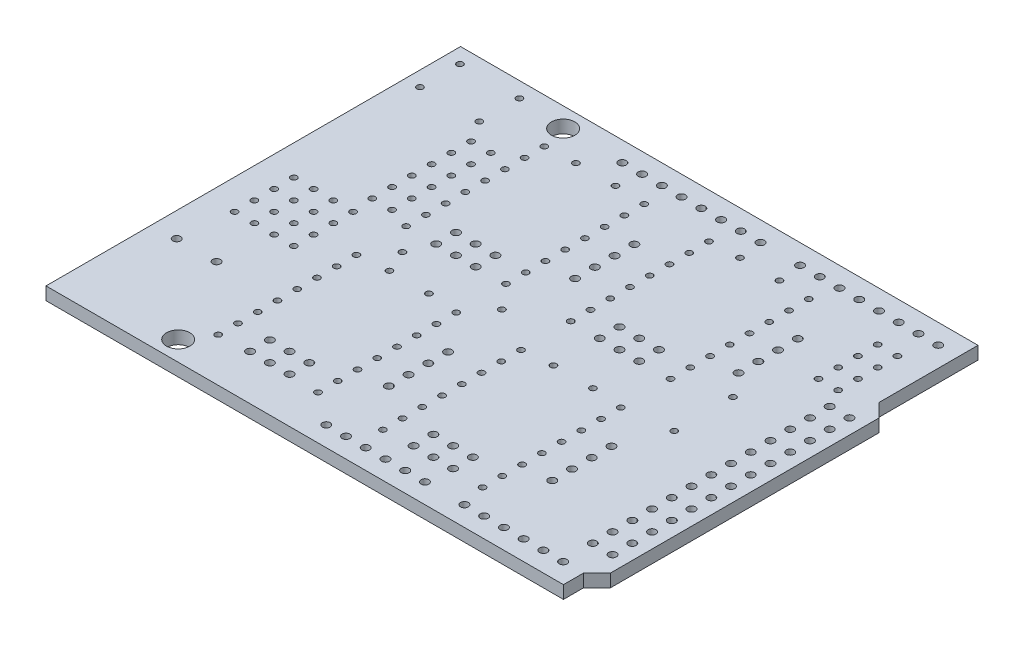
from build123d import *

# Parameters (mm, degrees)
SKETCH2_W             = 68.31
SKETCH2_H             = 53.34
BOSS_EXTRUDE1_DEPTH   = 1.65
SKETCH3_R             = 0.5
CUT_EXTRUDE1_DEPTH    = 87.68410581
SKETCH4_R             = 0.5
CUT_EXTRUDE2_DEPTH    = 87.68410581
SKETCH5_R             = 0.4
CUT_EXTRUDE3_DEPTH    = 87.68410581
LPATTERN4_COUNT       = 8
LPATTERN4_PITCH       = 2.54
LPATTERN5_COUNT       = 17
LPATTERN5_PITCH       = 2.54
LPATTERN6_COUNT       = 13
LPATTERN6_PITCH       = 2.54
SKETCH6_R             = 0.4
CUT_EXTRUDE4_DEPTH    = 87.68410581
LPATTERN7_COUNT       = 4
LPATTERN7_PITCH       = 2.54
LPATTERN7_COUNT_DIR2  = 4
LPATTERN7_PITCH_DIR2  = 2.54
SKETCH7_R             = 0.5
CUT_EXTRUDE5_DEPTH    = 87.68410581
SKETCH8_R             = 0.4
CUT_EXTRUDE6_DEPTH    = 87.68410581
LPATTERN8_COUNT       = 6
LPATTERN8_PITCH       = 2.54
LPATTERN8_COUNT_DIR2  = 2
LPATTERN8_PITCH_DIR2  = 2.54
SKETCH9_R             = 0.5
CUT_EXTRUDE7_DEPTH    = 87.68410581
LPATTERN9_COUNT       = 3
LPATTERN9_PITCH       = 2.54
LPATTERN9_COUNT_DIR2  = 2
LPATTERN9_PITCH_DIR2  = 2.54
SKETCH10_R            = 0.5
CUT_EXTRUDE8_DEPTH    = 87.68410581
LPATTERN10_COUNT      = 4
LPATTERN10_PITCH      = 2.54
SKETCH11_R            = 0.4
CUT_EXTRUDE9_DEPTH    = 87.68410581
LPATTERN11_COUNT      = 2
LPATTERN11_PITCH      = 5.08
SKETCH12_R            = 0.4
CUT_EXTRUDE10_DEPTH   = 87.68410581
SKETCH13_R            = 0.5
CUT_EXTRUDE11_DEPTH   = 87.68410581
LPATTERN12_COUNT      = 13
LPATTERN12_PITCH      = 2.54
LPATTERN12_COUNT_DIR2 = 2
LPATTERN12_PITCH_DIR2 = 2.54
SKETCH14_R            = 0.4
CUT_EXTRUDE12_DEPTH   = 87.68410581
LPATTERN13_COUNT      = 4
LPATTERN13_PITCH      = 2.54
LPATTERN13_COUNT_DIR2 = 2
LPATTERN13_PITCH_DIR2 = 2.54
SKETCH15_R            = 1.5
CUT_EXTRUDE13_DEPTH   = 87.68410581


with BuildPart() as part:
    # Sketch2 → Boss-Extrude1 (new body)
    with BuildSketch(Plane(origin=(0, 0, 0), x_dir=(1, 0, 0), z_dir=(0, 1, 0))):
        with Locations((34.155, 26.67)):
            Rectangle(SKETCH2_W, SKETCH2_H)
    extrude(amount=BOSS_EXTRUDE1_DEPTH)

    # Sketch3 → Cut-Extrude1 (cut, through all)
    with BuildSketch(Plane(origin=(0, 1.65, 0), x_dir=(1, 0, 0), z_dir=(0, 1, 0))):
        with Locations((64, 2.54)):
            Circle(SKETCH3_R)
    cut_extrude1 = extrude(amount=-CUT_EXTRUDE1_DEPTH, mode=Mode.SUBTRACT)

    # Sketch4 → Cut-Extrude2 (cut, through all)
    with BuildSketch(Plane(origin=(0, 1.65, 0), x_dir=(1, 0, 0), z_dir=(0, 1, 0))):
        with Locations((64, 50.8)):
            Circle(SKETCH4_R)
    cut_extrude2 = extrude(amount=-CUT_EXTRUDE2_DEPTH, mode=Mode.SUBTRACT)

    # Sketch5 → Cut-Extrude3 (cut, through all)
    with BuildSketch(Plane(origin=(0, 1.65, 0), x_dir=(1, 0, 0), z_dir=(0, 1, 0))):
        with Locations((16.52, 5.64)):
            Circle(SKETCH5_R)
        with Locations((29.36, 5.64)):
            Circle(SKETCH5_R)
        with Locations((16.52, 29.82)):
            Circle(SKETCH5_R)
        with Locations((29.36, 29.82)):
            Circle(SKETCH5_R)
        with Locations((37.7, 29.82)):
            Circle(SKETCH5_R)
        with Locations((50.54, 29.82)):
            Circle(SKETCH5_R)
        with Locations((50.54, 5.64)):
            Circle(SKETCH5_R)
        with Locations((37.7, 5.64)):
            Circle(SKETCH5_R)
    cut_extrude3 = extrude(amount=-CUT_EXTRUDE3_DEPTH, mode=Mode.SUBTRACT)

    # LPattern4: Cut-Extrude3 ×8
    with Locations(*[(0, 0, -i * LPATTERN4_PITCH) for i in range(1, LPATTERN4_COUNT)]):
        add(cut_extrude3, mode=Mode.SUBTRACT)

    # LPattern5: Cut-Extrude2 ×17, 1 skipped
    with Locations(*[(-i * LPATTERN5_PITCH, 0, 0) for i in range(1, LPATTERN5_COUNT) if i not in (8,)]):
        add(cut_extrude2, mode=Mode.SUBTRACT)

    # LPattern6: Cut-Extrude1 ×13, 1 skipped
    with Locations(*[(-i * LPATTERN6_PITCH, 0, 0) for i in range(1, LPATTERN6_COUNT) if i not in (6,)]):
        add(cut_extrude1, mode=Mode.SUBTRACT)

    # Sketch6 → Cut-Extrude4 (cut, through all)
    with BuildSketch(Plane(origin=(0, 1.65, 0), x_dir=(1, 0, 0), z_dir=(0, 1, 0))):
        with Locations((11.5, 20.39)):
            Circle(SKETCH6_R)
    cut_extrude4 = extrude(amount=-CUT_EXTRUDE4_DEPTH, mode=Mode.SUBTRACT)

    # LPattern7: Cut-Extrude4 4 × 4
    with Locations(*[(-j * LPATTERN7_PITCH_DIR2, 0, -i * LPATTERN7_PITCH) for i in range(LPATTERN7_COUNT) for j in range(LPATTERN7_COUNT_DIR2) if (i, j) != (0, 0)]):
        add(cut_extrude4, mode=Mode.SUBTRACT)

    # Sketch7 → Cut-Extrude5 (cut, through all)
    with BuildSketch(Plane(origin=(0, 1.65, 0), x_dir=(1, 0, 0), z_dir=(0, 1, 0))):
        with Locations((8.269754867, 13.67)):
            Circle(SKETCH7_R)
        with Locations((3.149754867, 13.67)):
            Circle(SKETCH7_R)
    extrude(amount=-CUT_EXTRUDE5_DEPTH, mode=Mode.SUBTRACT)

    # Sketch8 → Cut-Extrude6 (cut, through all)
    with BuildSketch(Plane(origin=(0, 1.65, 0), x_dir=(1, 0, 0), z_dir=(0, 1, 0))):
        with Locations((11.25, 30.74)):
            Circle(SKETCH8_R)
    cut_extrude6 = extrude(amount=-CUT_EXTRUDE6_DEPTH, mode=Mode.SUBTRACT)

    # LPattern8: Cut-Extrude6 6 × 2
    with Locations(*[(j * LPATTERN8_PITCH_DIR2, 0, -i * LPATTERN8_PITCH) for i in range(LPATTERN8_COUNT) for j in range(LPATTERN8_COUNT_DIR2) if (i, j) != (0, 0)]):
        add(cut_extrude6, mode=Mode.SUBTRACT)

    # Sketch9 → Cut-Extrude7 (cut, through all)
    with BuildSketch(Plane(origin=(0, 1.65, 0), x_dir=(1, 0, 0), z_dir=(0, 1, 0))):
        with Locations((20.43, 32.32)):
            Circle(SKETCH9_R)
        with Locations((20.43, 8.37)):
            Circle(SKETCH9_R)
        with Locations((41.47, 8.37)):
            Circle(SKETCH9_R)
        with Locations((41.47, 32.32)):
            Circle(SKETCH9_R)
    cut_extrude7 = extrude(amount=-CUT_EXTRUDE7_DEPTH, mode=Mode.SUBTRACT)

    # LPattern9: Cut-Extrude7 3 × 2
    with Locations(*[(i * LPATTERN9_PITCH, 0, j * LPATTERN9_PITCH_DIR2) for i in range(LPATTERN9_COUNT) for j in range(LPATTERN9_COUNT_DIR2) if (i, j) != (0, 0)]):
        add(cut_extrude7, mode=Mode.SUBTRACT)

    # Sketch10 → Cut-Extrude8 (cut, through all)
    with BuildSketch(Plane(origin=(0, 1.65, 0), x_dir=(1, 0, 0), z_dir=(0, 1, 0))):
        with Locations((33.22, 34.86)):
            Circle(SKETCH10_R)
        with Locations((33.22, 10.89)):
            Circle(SKETCH10_R)
        with Locations((54.25, 10.89)):
            Circle(SKETCH10_R)
        with Locations((54.25, 34.86)):
            Circle(SKETCH10_R)
    cut_extrude8 = extrude(amount=-CUT_EXTRUDE8_DEPTH, mode=Mode.SUBTRACT)

    # LPattern10: Cut-Extrude8 ×4
    with Locations(*[(0, 0, -i * LPATTERN10_PITCH) for i in range(1, LPATTERN10_COUNT)]):
        add(cut_extrude8, mode=Mode.SUBTRACT)

    # Sketch11 → Cut-Extrude9 (cut, through all)
    with BuildSketch(Plane(origin=(0, 1.65, 0), x_dir=(1, 0, 0), z_dir=(0, 1, 0))):
        with Locations((20.41, 23.78)):
            Circle(SKETCH11_R)
        with Locations((20.41, 47.78)):
            Circle(SKETCH11_R)
        with Locations((41.51, 47.78)):
            Circle(SKETCH11_R)
        with Locations((41.51, 23.78)):
            Circle(SKETCH11_R)
    cut_extrude9 = extrude(amount=-CUT_EXTRUDE9_DEPTH, mode=Mode.SUBTRACT)

    # LPattern11: Cut-Extrude9 ×2
    with Locations(*[(i * LPATTERN11_PITCH, 0, 0) for i in range(1, LPATTERN11_COUNT)]):
        add(cut_extrude9, mode=Mode.SUBTRACT)

    # Sketch12 → Cut-Extrude10 (cut, through all)
    with BuildSketch(Plane(origin=(0, 1.65, 0), x_dir=(1, 0, 0), z_dir=(0, 1, 0))):
        with Locations((9.56, 46.2)):
            Circle(SKETCH12_R)
        with Locations((9.56, 51.35)):
            Circle(SKETCH12_R)
        with Locations((1.91, 51.35)):
            Circle(SKETCH12_R)
        with Locations((1.91, 46.2)):
            Circle(SKETCH12_R)
        with Locations((19.16, 26.7)):
            Circle(SKETCH12_R)
        with Locations((31.96, 26.7)):
            Circle(SKETCH12_R)
        with Locations((56.58, 24.26)):
            Circle(SKETCH12_R)
        with Locations((56.58, 31.81)):
            Circle(SKETCH12_R)
    extrude(amount=-CUT_EXTRUDE10_DEPTH, mode=Mode.SUBTRACT)

    # Sketch13 → Cut-Extrude11 (cut, through all)
    with BuildSketch(Plane(origin=(0, 1.65, 0), x_dir=(1, 0, 0), z_dir=(0, 1, 0))):
        with Locations((63.86, 6.5)):
            Circle(SKETCH13_R)
    cut_extrude11 = extrude(amount=-CUT_EXTRUDE11_DEPTH, mode=Mode.SUBTRACT)

    # LPattern12: Cut-Extrude11 13 × 2
    with Locations(*[(j * LPATTERN12_PITCH_DIR2, 0, -i * LPATTERN12_PITCH) for i in range(LPATTERN12_COUNT) for j in range(LPATTERN12_COUNT_DIR2) if (i, j) != (0, 0)]):
        add(cut_extrude11, mode=Mode.SUBTRACT)

    # Sketch14 → Cut-Extrude12 (cut, through all)
    with BuildSketch(Plane(origin=(0, 1.65, 0), x_dir=(1, 0, 0), z_dir=(0, 1, 0))):
        with Locations((60.05, 39.34)):
            Circle(SKETCH14_R)
    cut_extrude12 = extrude(amount=-CUT_EXTRUDE12_DEPTH, mode=Mode.SUBTRACT)

    # LPattern13: Cut-Extrude12 4 × 2
    with Locations(*[(j * LPATTERN13_PITCH_DIR2, 0, -i * LPATTERN13_PITCH) for i in range(LPATTERN13_COUNT) for j in range(LPATTERN13_COUNT_DIR2) if (i, j) != (0, 0)]):
        add(cut_extrude12, mode=Mode.SUBTRACT)

    # Sketch15 → Cut-Extrude13 (cut, through all)
    with BuildSketch(Plane(origin=(0, 1.65, 0), x_dir=(1, 0, 0), z_dir=(0, 1, 0))):
        with Locations((15.74, 50.8)):
            Circle(SKETCH15_R)
        with Locations((14.47, 2.54)):
            Circle(SKETCH15_R)
        Polygon((66.58, 40.57), (66.58, 53.34), (68.31, 53.34), (68.31, 38.84), align=None)
        Polygon((66.58, 0), (66.58, 2.57), (68.31, 4.3), (68.31, 0), align=None)
    extrude(amount=-CUT_EXTRUDE13_DEPTH, mode=Mode.SUBTRACT)


solid = part.part
